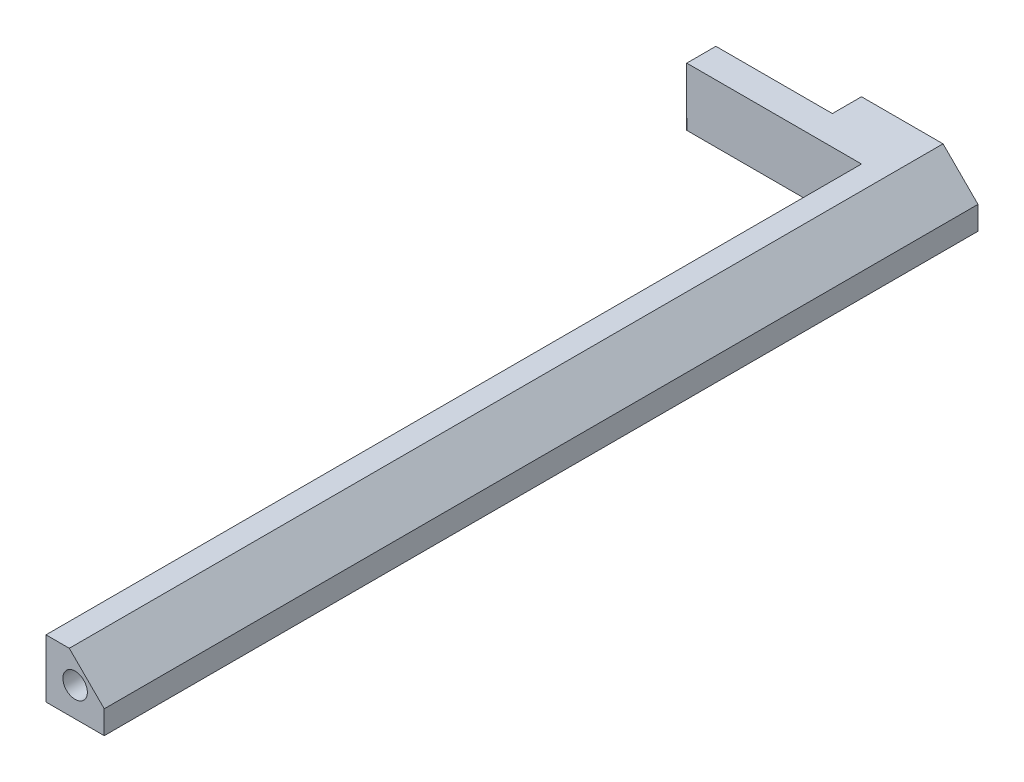
from build123d import *

# Parameters (mm, degrees)
DODANIE_WYCI_GNI_CIE1_DEPTH = 10
SZKIC2_R                    = 2.1
WYTNIJ_WYCI_GNI_CIE1_DEPTH  = 4
SZKIC3_R                    = 2.1
WYTNIJ_WYCI_GNI_CIE2_DEPTH  = 4
SFAZOWANIE1_SIZE            = 6


with BuildPart() as part:
    # Szkic1 → Dodanie-wyciągnięcie1 (new body)
    with BuildSketch(Plane(origin=(0, 0, 0), x_dir=(1, 0, 0), z_dir=(0, 1, 0))):
        Polygon((0, 0), (0, 150), (-20, 150), (-20, 145), (-40, 145), (-40, 140), (-10, 140), (-10, 0), align=None)
    extrude(amount=DODANIE_WYCI_GNI_CIE1_DEPTH)

    # Szkic2 → Wytnij-wyciągnięcie1 (cut)
    with BuildSketch(Plane.XZ):
        with Locations((-7.2, -123)):
            Circle(SZKIC2_R)
        with Locations((-7.2, -27)):
            Circle(SZKIC2_R)
    extrude(amount=-WYTNIJ_WYCI_GNI_CIE1_DEPTH, mode=Mode.SUBTRACT)

    # Szkic3 → Wytnij-wyciągnięcie2 (cut)
    with BuildSketch(Plane.XY):
        with Locations((-5, 5)):
            Circle(SZKIC3_R)
    extrude(amount=-WYTNIJ_WYCI_GNI_CIE2_DEPTH, mode=Mode.SUBTRACT)

    # Sfazowanie1
    sfazowanie1_edges = [part.edges().sort_by_distance(p)[0] for p in [
        (0, 10, -75),
    ]]
    chamfer(sfazowanie1_edges, length=SFAZOWANIE1_SIZE)


solid = part.part
